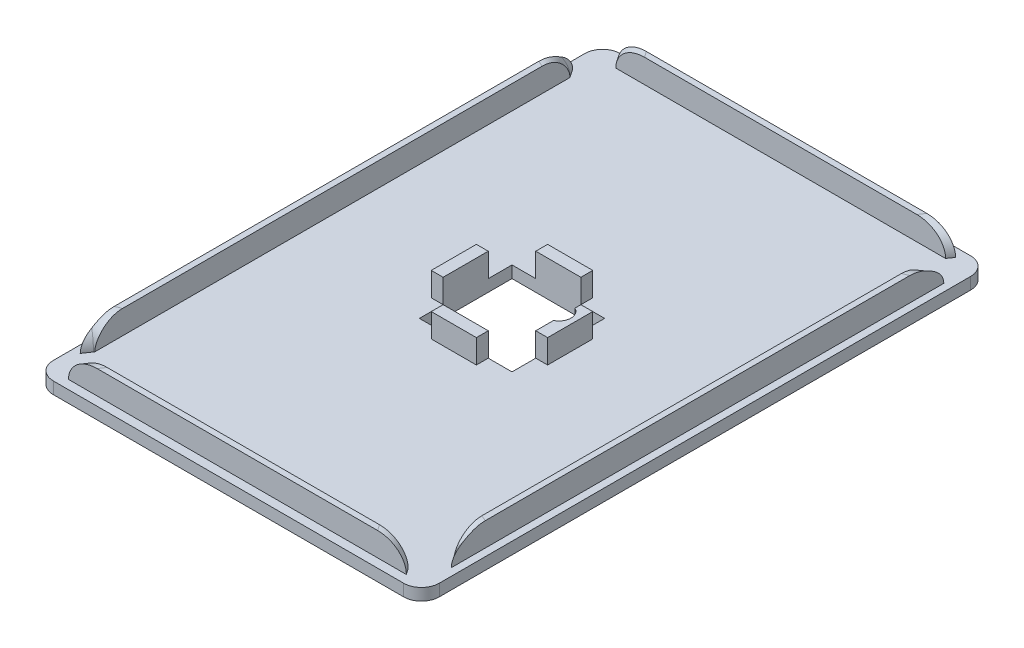
from build123d import *

# Parameters (mm, degrees)
BOSS_EXTRUDE1_DEPTH = 2
SKETCH1_3_W         = 62.50000000000001
SKETCH1_3_H         = 92.5
BOSS_EXTRUDE2_DEPTH = 6
BOSS_EXTRUDE3_DEPTH = 6
CUT_EXTRUDE2_DEPTH  = 39.00000000000001
CUT_EXTRUDE3_START  = 2
CUT_EXTRUDE3_DEPTH  = 8
FILLET1_R           = 4
BOSS_EXTRUDE4_DEPTH = 1
CUT_EXTRUDE7_DEPTH  = 4
FILLET2_R           = 3
SKETCH9_W           = 5.999999999999999
SKETCH9_H           = 6
SKETCH9_H_2         = 5.999999999999999
CUT_EXTRUDE8_DEPTH  = 10


with BuildPart() as part:
    # Sketch1 → Boss-Extrude1 (new body)
    with BuildSketch(Plane(origin=(0, 0, 0), x_dir=(1, 0, 0), z_dir=(0, 1, 0))):
        Polygon((-32.5, 47.74999999999999), (32.5, 47.74999999999999), (32.50000000000001, -47.75000000000001), (-32.49999999999998, -47.75000000000001), align=None)
    extrude(amount=BOSS_EXTRUDE1_DEPTH)

    # Sketch1<3> → Boss-Extrude2 (add)
    with BuildSketch(Plane(origin=(0, 0, 0), x_dir=(1, 0, 0), z_dir=(0, 1, 0))):
        Rectangle(SKETCH1_3_W, SKETCH1_3_H)
    extrude(amount=BOSS_EXTRUDE2_DEPTH)

    # Sketch2<4> → Boss-Extrude3 (add)
    with BuildSketch(Plane(origin=(0, 0, 0), x_dir=(1, 0, 0), z_dir=(0, 1, 0))):
        Polygon((-9.799999999999999, -9.799999999999999), (9.799999999999999, -9.799999999999999), (9.799999999999997, 9.799999999999999), (-9.8, 9.799999999999999), align=None)
    extrude(amount=BOSS_EXTRUDE3_DEPTH)

    # Sketch2 → Cut-Extrude2 (cut)
    with BuildSketch(Plane(origin=(0, 0, 0), x_dir=(1, 0, 0), z_dir=(0, 1, 0))):
        with BuildLine():
            Line((-7.800000000000002, 7.800000000000001), (-7.8, -7.799999999999999))
            Line((-7.8, -7.799999999999999), (7.8, -7.799999999999999))
            Line((7.8, -7.799999999999999), (7.8, -0.7999999999999989))
            ThreePointArc((7.8, -0.7999999999999985), (8.928220211291862, 1.0000000000000016), (7.799999999999999, 2.8000000000000007))
            Line((7.7999999999999785, 2.8000000000000007), (7.799999999999998, 7.800000000000001))
            Line((7.799999999999998, 7.800000000000001), (-7.800000000000002, 7.800000000000001))
        make_face()
    extrude(amount=CUT_EXTRUDE2_DEPTH, mode=Mode.SUBTRACT)

    # Sketch3 → Cut-Extrude3 (cut)
    with BuildSketch(Plane(origin=(0, 0, 0), x_dir=(1, 0, 0), z_dir=(0, 1, 0)).offset(CUT_EXTRUDE3_START)):
        with BuildLine():
            Line((-30.43328770425558, 49.15666281909306), (-34.56671229574442, 46.343337180906936))
            Line((-34.56671229574442, 46.343337180906936), (-30.34672383846524, 40.14320029367368))
            ThreePointArc((-30.346723838465234, 40.14320029367369), (-26.87334872362776, 39.48315081702232), (-26.213299246976405, 42.9565259318598))
            Line((-26.2132992469764, 42.9565259318598), (-30.43328770425558, 49.15666281909306))
        make_face()
        with BuildLine():
            Line((34.56671229574442, 46.343337180906936), (30.43328770425558, 49.15666281909306))
            Line((30.43328770425558, 49.15666281909306), (26.21329924697641, 42.9565259318598))
            ThreePointArc((26.213299246976415, 42.956525931859794), (26.87334872362777, 39.48315081702232), (30.346723838465245, 40.14320029367368))
            Line((30.346723838465245, 40.14320029367368), (34.56671229574442, 46.343337180906936))
        make_face()
        with BuildLine():
            Line((-30.346723838465223, -40.143200293673694), (-34.566712295744395, -46.34333718090695))
            Line((-34.566712295744395, -46.34333718090695), (-30.43328770425555, -49.15666281909307))
            Line((-30.43328770425555, -49.15666281909307), (-26.213299246976373, -42.95652593185982))
            ThreePointArc((-26.213299246976383, -42.956525931859815), (-26.873348723627743, -39.48315081702233), (-30.346723838465227, -40.143200293673694))
        make_face()
        with BuildLine():
            Line((26.213299246976398, -42.95652593185982), (30.433287704255594, -49.15666281909309))
            Line((30.433287704255594, -49.15666281909309), (34.56671229574444, -46.34333718090698))
            Line((34.56671229574444, -46.34333718090698), (30.34672383846524, -40.143200293673694))
            ThreePointArc((30.346723838465252, -40.14320029367369), (26.873348723627778, -39.48315081702233), (26.213299246976423, -42.95652593185981))
        make_face()
    extrude(amount=CUT_EXTRUDE3_DEPTH, mode=Mode.SUBTRACT)

    # Fillet1
    # the kernel refuses this fillet: 4 mm, written as the material it takes off along each edge
    with BuildSketch(Plane(origin=(-36.87665127637225, 6, 49.73717060629096), x_dir=(-0.8266849182977679, 0, -0.5626651276372232), z_dir=(0.5626651276372232, 0, -0.826684918297768))) as fillet1_piece_1:
        with BuildLine():
            CenterArc((FILLET1_R, -FILLET1_R), FILLET1_R, 90, 90)
            Line((0, -FILLET1_R), (0, 0))
            Line((0, 0), (FILLET1_R, 0))
        make_face()
    extrude(amount=11.605353019348973, mode=Mode.SUBTRACT)
    with BuildSketch(Plane(origin=(-26.213299246976373, 6, 42.95652593185982), x_dir=(0.8266849182977672, 0, 0.5626651276372243), z_dir=(-0.5626651276372243, 0, 0.8266849182977672))) as fillet1_piece_2:
        with BuildLine():
            CenterArc((FILLET1_R, -FILLET1_R), FILLET1_R, 90, 90)
            Line((-1.06e-15, -FILLET1_R), (0, 0))
            Line((0, 0), (FILLET1_R, 0))
        make_face()
    extrude(amount=13.983953251405376, mode=Mode.SUBTRACT)
    with BuildSketch(Plane(origin=(34.0815820880514, 6, 54.51684918297768), x_dir=(-0.826684918297767, 0, 0.5626651276372246), z_dir=(-0.5626651276372246, 0, -0.826684918297767))) as fillet1_piece_3:
        with BuildLine():
            CenterArc((FILLET1_R, -FILLET1_R), FILLET1_R, 90, 90)
            Line((-1.88e-15, -FILLET1_R), (0, 0))
            Line((0, 0), (FILLET1_R, 0))
        make_face()
    extrude(amount=13.983953251405392, mode=Mode.SUBTRACT)
    with BuildSketch(Plane(origin=(30.346723838465245, 6, 40.1432002936737), x_dir=(0.8266849182977677, 0, -0.5626651276372238), z_dir=(0.5626651276372238, 0, 0.8266849182977677))) as fillet1_piece_4:
        with BuildLine():
            CenterArc((FILLET1_R, -FILLET1_R), FILLET1_R, 90, 90)
            Line((0, -FILLET1_R), (0, 0))
            Line((0, 0), (FILLET1_R, 0))
        make_face()
    extrude(amount=11.605353019348959, mode=Mode.SUBTRACT)
    with BuildSketch(Plane(origin=(36.87665127637224, 6, -49.73717060629088), x_dir=(0.8266849182977675, 0, 0.562665127637224), z_dir=(-0.562665127637224, 0, 0.8266849182977676))) as fillet1_piece_5:
        with BuildLine():
            CenterArc((FILLET1_R, -FILLET1_R), FILLET1_R, 90, 90)
            Line((-4e-15, -FILLET1_R), (0, 0))
            Line((0, 0), (FILLET1_R, 0))
        make_face()
    extrude(amount=11.605353019348904, mode=Mode.SUBTRACT)
    with BuildSketch(Plane(origin=(26.21329924697641, 6, -42.9565259318598), x_dir=(-0.826684918297768, 0, -0.5626651276372232), z_dir=(0.5626651276372232, 0, -0.826684918297768))) as fillet1_piece_6:
        with BuildLine():
            CenterArc((FILLET1_R, -FILLET1_R), FILLET1_R, 90, 90)
            Line((-1.88e-15, -FILLET1_R), (0, 0))
            Line((0, 0), (FILLET1_R, 0))
        make_face()
    extrude(amount=13.98395325140539, mode=Mode.SUBTRACT)
    with BuildSketch(Plane(origin=(-34.08158208805138, 6, -54.51684918297765), x_dir=(0.8266849182977676, 0, -0.562665127637224), z_dir=(0.562665127637224, 0, 0.8266849182977676))) as fillet1_piece_7:
        with BuildLine():
            CenterArc((FILLET1_R, -FILLET1_R), FILLET1_R, 90, 90)
            Line((0, -FILLET1_R), (0, 0))
            Line((0, 0), (FILLET1_R, 0))
        make_face()
    extrude(amount=13.983953251405376, mode=Mode.SUBTRACT)
    with BuildSketch(Plane(origin=(-30.34672383846524, 6, -40.14320029367368), x_dir=(-0.8266849182977674, 0, 0.5626651276372242), z_dir=(-0.5626651276372242, 0, -0.8266849182977674))) as fillet1_piece_8:
        with BuildLine():
            CenterArc((FILLET1_R, -FILLET1_R), FILLET1_R, 90, 90)
            Line((1.06e-15, -FILLET1_R), (0, 0))
            Line((0, 0), (FILLET1_R, 0))
        make_face()
    extrude(amount=11.605353019348907, mode=Mode.SUBTRACT)
    with BuildSketch(Plane(origin=(-28.2800115427208, 6, 41.549863112766744), x_dir=(-0.8266849182977704, 0, -0.5626651276372198), z_dir=(-0.5626651276372198, 0, 0.8266849182977704))) as fillet1_piece_9:
        with BuildLine():
            CenterArc((2.5000000000000013 + FILLET1_R, FILLET1_R), FILLET1_R, 180, 90)
            Line((2.4999999999999996, FILLET1_R), (2.5000000000000013, 0))
            Line((2.5000000000000013, 0), (2.5000000000000013 + FILLET1_R, 0))
        make_face()
    revolve(axis=Axis((-28.2800115427208, 6, 41.549863112766744), (0, -1, 0)), revolution_arc=180.0000000000006, mode=Mode.SUBTRACT)
    with BuildSketch(Plane(origin=(28.280011542720835, 6, 41.549863112766744), x_dir=(-0.8266849182977659, 0, 0.5626651276372262), z_dir=(0.5626651276372262, 0, 0.8266849182977659))) as fillet1_piece_10:
        with BuildLine():
            CenterArc((2.499999999999998 + FILLET1_R, FILLET1_R), FILLET1_R, 180, 90)
            Line((2.4999999999999996, FILLET1_R), (2.499999999999998, 0))
            Line((2.499999999999998, 0), (2.499999999999998 + FILLET1_R, 0))
        make_face()
    revolve(axis=Axis((28.280011542720835, 6, 41.549863112766744), (0, -1, 0)), revolution_arc=180.00000000000017, mode=Mode.SUBTRACT)
    with BuildSketch(Plane(origin=(28.28001154272083, 6, -41.54986311276673), x_dir=(0.826684918297769, 0, 0.5626651276372218), z_dir=(0.5626651276372218, 0, -0.826684918297769))) as fillet1_piece_11:
        with BuildLine():
            CenterArc((2.499999999999993 + FILLET1_R, FILLET1_R), FILLET1_R, 180, 90)
            Line((2.49999999999999, FILLET1_R), (2.499999999999993, 0))
            Line((2.499999999999993, 0), (2.499999999999993 + FILLET1_R, 0))
        make_face()
    revolve(axis=Axis((28.28001154272083, 6, -41.54986311276673), (0, -1, 0)), revolution_arc=180.00000000000037, mode=Mode.SUBTRACT)
    with BuildSketch(Plane(origin=(-28.280011542720814, 6, -41.54986311276674), x_dir=(0.8266849182977655, 0, -0.562665127637227), z_dir=(-0.562665127637227, 0, -0.8266849182977655))) as fillet1_piece_12:
        with BuildLine():
            CenterArc((2.499999999999995 + FILLET1_R, FILLET1_R), FILLET1_R, 180, 90)
            Line((2.499999999999995, FILLET1_R), (2.499999999999995, 0))
            Line((2.499999999999995, 0), (2.499999999999995 + FILLET1_R, 0))
        make_face()
    revolve(axis=Axis((-28.280011542720814, 6, -41.54986311276674), (0, -1, 0)), revolution_arc=180.0000000000004, mode=Mode.SUBTRACT)

    # Sketch7 → Boss-Extrude4 (add)
    with BuildSketch(Plane(origin=(0, 0, 0), x_dir=(1, 0, 0), z_dir=(0, 1, 0))):
        with BuildLine():
            Line((7.799999999999999, 2.8000000000000003), (7.799999999999998, -0.799999999999999))
            ThreePointArc((7.799999999999998, -0.799999999999999), (8.928220211291862, 1.0000000000000004), (7.799999999999999, 2.8000000000000003))
        make_face()
    extrude(amount=BOSS_EXTRUDE4_DEPTH)

    # Sketch5 → Cut-Extrude7 (cut)
    with BuildSketch(Plane(origin=(0, 6, 0), x_dir=(1, 0, 0), z_dir=(0, 1, 0))):
        Polygon((-21.75628660862557, -45.25000000000001), (21.756286608625608, -45.25000000000001), (30.25, -45.25000000000001), (30.25, -34.31321019320602), (30.25, 34.31321019320601), (30.25, 45.24999999999999), (21.7562866086256, 45.24999999999999), (-21.75628660862558, 45.24999999999999), (-30.25, 45.24999999999999), (-30.25, 34.31321019320601), (-30.25, -34.31321019320603), (-30.25, -45.25000000000001), align=None)
        Polygon((9.799999999999999, -9.799999999999999), (-9.799999999999999, -9.799999999999999), (-9.800000000000002, 9.799999999999999), (9.799999999999995, 9.799999999999999), align=None, mode=Mode.SUBTRACT)
    extrude(amount=-CUT_EXTRUDE7_DEPTH, mode=Mode.SUBTRACT)

    # Fillet2
    fillet2_edges = [part.edges().sort_by_distance(p)[0] for p in [
        (-32.5, 1, -47.74999999999999),
        (32.5, 1, -47.74999999999999),
        (32.50000000000001, 1, 47.75000000000001),
        (-32.49999999999998, 1, 47.75000000000001),
    ]]
    fillet(fillet2_edges, radius=FILLET2_R)

    # Sketch9 → Cut-Extrude8 (cut)
    with BuildSketch(Plane(origin=(0, 2, 0), x_dir=(1, 0, 0), z_dir=(0, 1, 0))):
        Polygon((-9.800000000000002, 9.799999999999999), (-3.800000000000001, 9.799999999999999), (-3.8000000000000003, 3.7999999999999994), (-9.800000000000002, 3.7999999999999994), align=None)
        with Locations((-6.799999999999999, -6.799999999999999)):
            Rectangle(SKETCH9_W, SKETCH9_H)
        with Locations((6.799999999999999, -6.799999999999999)):
            Rectangle(SKETCH9_W, SKETCH9_H_2)
        Polygon((9.799999999999995, 9.799999999999999), (3.7999999999999954, 9.799999999999999), (3.7999999999999963, 3.7999999999999985), (9.799999999999995, 3.7999999999999994), align=None)
    extrude(amount=CUT_EXTRUDE8_DEPTH, mode=Mode.SUBTRACT)


solid = part.part
